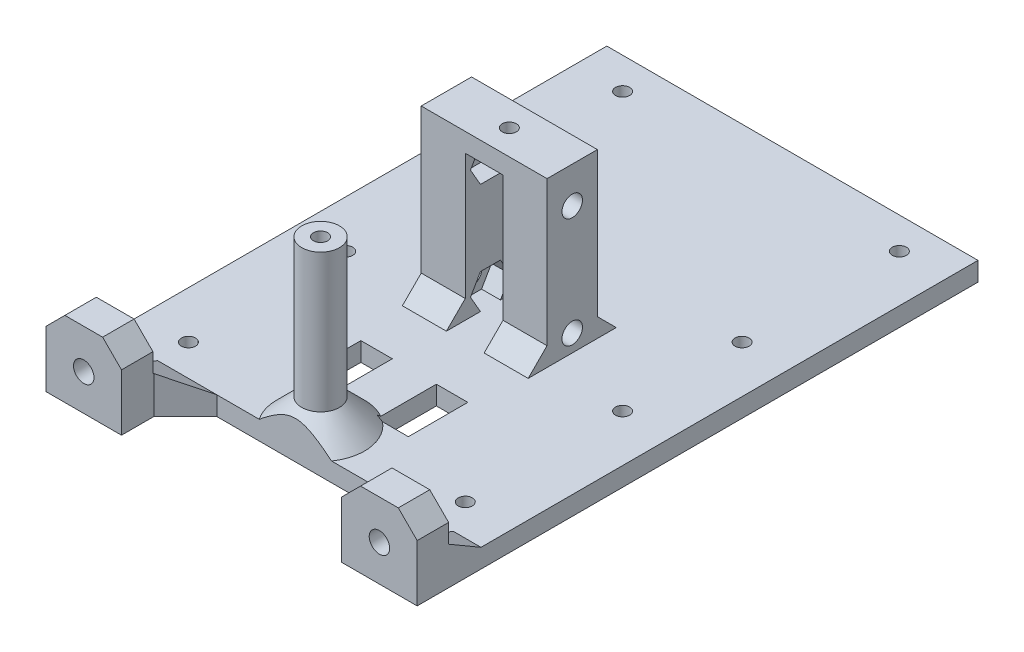
from build123d import *

# Parameters (mm, degrees)
BASE_DEPTH                     = 3
SKETCH1_W                      = 20
SKETCH1_H                      = 7
SKETCH1_H_2                    = 8
SKETCH1_W_2                    = 7
SKETCH1_H_3                    = 38.5
SOPORTE_MOTORES_DEPTH          = 23
SOPORTE_PALA_DEPTH             = 85.65548432
SKETCH3_R                      = 1.625
AGUJEROS_MOTORES_DEPTH         = 73.427902257
SKETCH4_R                      = 1
AGUJEROS_PALA_DEPTH            = 4
HUECO_SOPORTE_POSTERIOR_DEPTH  = 10
CORTE_SOPORTE_PALA_MOTOR_REACH = 71.098
BOSS_EXTRUDE2_DEPTH            = 20
CHAMFER1_SIZE                  = 3
CORTAR_EXTRUIR1_DEPTH          = 85.65548432
CORTAR_EXTRUIR1_DEPTH_BACK     = 85.65548432
SALIENTE_EXTRUIR1_START        = -59
SALIENTE_EXTRUIR1_DEPTH        = 12
SALIENTE_EXTRUIR2_DEPTH        = 12
CHAFL_N1_SIZE                  = 5
CROQUIS7_R                     = 1.625
CORTAR_EXTRUIR2_DEPTH          = 12
CORTAR_EXTRUIR3_DEPTH          = 15
CORTAR_EXTRUIR3_DEPTH_BACK     = 2.5
CORTAR_EXTRUIR5_DEPTH          = 86.730127162
CORTAR_EXTRUIR5_DEPTH_BACK     = 86.730127162
CROQUIS10_W                    = 13.75510153
CROQUIS10_H                    = 25.014777128
SALIENTE_EXTRUIR3_START        = -20
CROQUIS11_W                    = 8
CROQUIS11_H                    = 3
SALIENTE_EXTRUIR3_DEPTH        = 20
CORTAR_EXTRUIR6_START          = -11
CROQUIS12_W                    = 6
CROQUIS12_H                    = 23
CORTAR_EXTRUIR6_DEPTH          = 14
CORTAR_EXTRUIR7_DEPTH          = 9
CORTAR_EXTRUIR7_DEPTH_BACK     = 3
CHAFL_N2_SIZE                  = 3
CROQUIS14_R                    = 3
CROQUIS14_R_2                  = 1.125
SALIENTE_EXTRUIR4_DEPTH        = 26
CHAFL_N3_SIZE                  = 4
CORTAR_EXTRUIR8_REACH          = 72.028
CROQUIS15_R                    = 1.125
CROQUIS16_R                    = 1.125
CORTAR_EXTRUIR9_DEPTH          = 69.839702957


with BuildPart() as part:
    # Croquis1 → Base (new body)
    with BuildSketch(Plane(origin=(0, 0, 0), x_dir=(1, 0, 0), z_dir=(0, 1, 0))):
        Polygon((-29.5, 32.640625), (29.5, 32.640625), (29.5, -47.359375), (8.5, -47.359375), (8.5, -27.453125), (3.5, -27.453125), (3.5, -47.359375), (-3.5, -47.359375), (-3.5, -27.453125), (-8.5, -27.453125), (-8.5, -47.359375), (-29.5, -47.359375), align=None)
    extrude(amount=BASE_DEPTH)

    # Sketch1 → Soporte Motores (add)
    with BuildSketch(Plane(origin=(0, 3, 0), x_dir=(1, 0, 0), z_dir=(0, 1, 0))):
        with Locations((0, 19.640625)):
            Rectangle(SKETCH1_W, SKETCH1_H)
        with Locations((0, -12.359375)):
            Rectangle(SKETCH1_W, SKETCH1_H_2)
        with Locations((0, -35.609375)):
            Rectangle(SKETCH1_W_2, SKETCH1_H_3)
    extrude(amount=SOPORTE_MOTORES_DEPTH)

    # Sketch2 → Soporte Pala (cut, through all)
    with BuildSketch(Plane(origin=(29.5, 0, 0), x_dir=(0, 0, -1), z_dir=(1, 0, 0))):
        Polygon((-54.859375, 26), (-46.359375, 0), (-47.359375, 0), (-47.359375, 3), (-54.859375, 3), align=None)
    extrude(amount=-SOPORTE_PALA_DEPTH, mode=Mode.SUBTRACT)

    # Sketch3 → Agujeros Motores (cut, through all)
    with BuildSketch(Plane.ZY.offset(10)):
        with Locations((12.359375, 5.75)):
            Circle(SKETCH3_R)
        with Locations((12.359375, 23.25)):
            Circle(SKETCH3_R)
    extrude(amount=-AGUJEROS_MOTORES_DEPTH, mode=Mode.SUBTRACT)

    # Sketch4 → Agujeros pala (cut)
    with BuildSketch(Plane(origin=(0, -13.692511694, 41.882976946), x_dir=(1, 0, 0), z_dir=(0, -0.31073885630742226, 0.9504953251756452))):
        with Locations(Location((0, 19.405659167, 0), (0, 0, 270))):
            Circle(SKETCH4_R)
        with Locations(Location((0, 29.405659167, 0), (0, 0, 270))):
            Circle(SKETCH4_R)
    extrude(amount=-AGUJEROS_PALA_DEPTH, mode=Mode.SUBTRACT)

    # Croquis2 → Hueco Soporte Posterior (cut)
    with BuildSketch(Plane(origin=(0, 0, -23.140625), x_dir=(-1, 0, 0), z_dir=(0, 0, -1))):
        Polygon((-5, 6), (-5, 3), (5, 3), (5, 6), (5, 21), (-5, 21), align=None)
    extrude(amount=-HUECO_SOPORTE_POSTERIOR_DEPTH, mode=Mode.SUBTRACT)

    # Croquis3 → Corte_Soporte_PALA_MOTOR (cut, up to next)
    with BuildSketch(Plane.ZY.offset(3.5), mode=Mode.PRIVATE) as corte_soporte_pala_motor_sk1:
        Polygon((21.90625, 3), (36.90625, 3), (36.90625, 26), (21.90625, 26), (16.359375, 26), (16.359375, 3), align=None)
    corte_soporte_pala_motor_tool1 = extrude(corte_soporte_pala_motor_sk1.sketch, amount=-CORTE_SOPORTE_PALA_MOTOR_REACH, mode=Mode.PRIVATE) & part.part
    add(corte_soporte_pala_motor_tool1.solids().sort_by_distance((-3.5, 14.5, 26.632812))[0], mode=Mode.SUBTRACT)

    # Sketch5 → Boss-Extrude2 (add)
    with BuildSketch(Plane(origin=(-8.5, 0, 0), x_dir=(0, 0, -1), z_dir=(1, 0, 0))):
        Polygon((-36.90625, 3), (-36.90625, 0), (-46.359375, 0), (-47.340144231, 3), align=None)
    extrude(amount=BOSS_EXTRUDE2_DEPTH)

    # Chamfer1
    # the kernel refuses this chamfer: 3 mm, written as the material it adds along each edge
    with BuildSketch(Plane(origin=(10, 3, -16.140625), x_dir=(0, -0.02749587661058635, 0.9996219169112968), z_dir=(-1, 0, 0)), Plane(origin=(5, 3, -23.140625), x_dir=(0, -0.027495876610586365, -0.9996219169112968), z_dir=(1, 0, 0)), Plane(origin=(-5, 3, -16.140625), x_dir=(0, -0.02749587661058635, 0.9996219169112968), z_dir=(-1, 0, 0)), Plane(origin=(-10, 3, -23.140625), x_dir=(0, -0.027495876610586365, -0.9996219169112968), z_dir=(1, 0, 0))) as chamfer1_piece_1:
        Polygon((CHAMFER1_SIZE * 0.999621916911, CHAMFER1_SIZE * 0.0274958766106), (-CHAMFER1_SIZE * 0.0274958766106, CHAMFER1_SIZE * 0.999621916911), (0, 0), align=None)
    extrude(amount=5)
    with BuildSketch(Plane(origin=(-5, 3, -23.140625), x_dir=(0.9996219169112968, -0.027495876610586348, 0), z_dir=(0, 0, 1))) as chamfer1_piece_2:
        Polygon((CHAMFER1_SIZE * 0.999621916911, CHAMFER1_SIZE * 0.0274958766106), (-CHAMFER1_SIZE * 0.0274958766106, CHAMFER1_SIZE * 0.999621916911), (0, 0), align=None)
    extrude(amount=7)
    with BuildSketch(Plane(origin=(5, 3, -23.140625), x_dir=(-0.9996219169112968, -0.027495876610586348, 0), z_dir=(0, 0, 1))) as chamfer1_piece_3:
        Polygon((CHAMFER1_SIZE * 0.999621916911, -CHAMFER1_SIZE * 0.0274958766106), (-CHAMFER1_SIZE * 0.0274958766106, -CHAMFER1_SIZE * 0.999621916911), (0, 0), align=None)
    extrude(amount=7)
    with BuildSketch(Plane(origin=(-3.5, 3, 55.055193195), x_dir=(-0.9996219169112969, -0.027495876610586348, 0), z_dir=(0, 0, -1))) as chamfer1_piece_4_section:
        Polygon((CHAMFER1_SIZE * 0.999621916911, CHAMFER1_SIZE * 0.0274958766106), (-CHAMFER1_SIZE * 0.0274958766106, CHAMFER1_SIZE * 0.999621916911), (0, 0), align=None)
    chamfer1_piece_4 = extrude(amount=18.148943195, mode=Mode.PRIVATE)
    chamfer1_piece_4 = split(chamfer1_piece_4, bisect_by=Plane(origin=(-4.480095354, 2.417288908, 47.149642528), z_dir=(0, 0.3107388563074222, -0.9504953251756452)), keep=Keep.TOP, mode=Mode.PRIVATE)
    add(chamfer1_piece_4)
    with BuildSketch(Plane(origin=(3.5, 3, 36.90625), x_dir=(0.9996219169112969, -0.027495876610586348, 0), z_dir=(0, 0, 1))) as chamfer1_piece_5_section:
        Polygon((CHAMFER1_SIZE * 0.999621916911, CHAMFER1_SIZE * 0.0274958766106), (-CHAMFER1_SIZE * 0.0274958766106, CHAMFER1_SIZE * 0.999621916911), (0, 0), align=None)
    chamfer1_piece_5 = extrude(amount=18.148943195, mode=Mode.PRIVATE)
    chamfer1_piece_5 = split(chamfer1_piece_5, bisect_by=Plane(origin=(4.480095354, 2.417288908, 47.149642528), z_dir=(0, 0.3107388563074222, -0.9504953251756452)), keep=Keep.TOP, mode=Mode.PRIVATE)
    add(chamfer1_piece_5)
    with BuildSketch(Plane(origin=(-10, 3, 8.359375), x_dir=(0, -0.02749587661058634, -0.9996219169112968), z_dir=(1, 0, 0)), Plane(origin=(10, 3, 16.359375), x_dir=(0, -0.027495876610586334, 0.9996219169112968), z_dir=(-1, 0, 0))) as chamfer1_piece_6:
        Polygon((CHAMFER1_SIZE * 0.999621916911, CHAMFER1_SIZE * 0.0274958766106), (-CHAMFER1_SIZE * 0.0274958766106, CHAMFER1_SIZE * 0.999621916911), (0, 0), align=None)
    extrude(amount=20)
    with BuildSketch(Plane(origin=(5, 3, -23.140625), x_dir=(-0.9996219169112968, -0.027495876610586348, 0), z_dir=(0, 0, 1))) as chamfer1_piece_7a_section:
        Polygon((CHAMFER1_SIZE * 0.999621916911, -CHAMFER1_SIZE * 0.0274958766106), (-CHAMFER1_SIZE * 0.0274958766106, -CHAMFER1_SIZE * 0.999621916911), (0, 0), align=None)
    chamfer1_piece_7a = extrude(amount=14.715048964, mode=Mode.PRIVATE)
    chamfer1_piece_7a = split(chamfer1_piece_7a, bisect_by=Plane(origin=(4.01061912, 3.98938088, -16.140625), z_dir=(0, 0, 1)), keep=Keep.TOP, mode=Mode.PRIVATE)
    with BuildSketch(Plane(origin=(10, 3, -16.140625), x_dir=(0, -0.02749587661058635, 0.9996219169112968), z_dir=(-1, 0, 0))) as chamfer1_piece_7b_section:
        Polygon((CHAMFER1_SIZE * 0.999621916911, CHAMFER1_SIZE * 0.0274958766106), (-CHAMFER1_SIZE * 0.0274958766106, CHAMFER1_SIZE * 0.999621916911), (0, 0), align=None)
    chamfer1_piece_7b = extrude(amount=12.715048964, mode=Mode.PRIVATE)
    chamfer1_piece_7b = split(chamfer1_piece_7b, bisect_by=Plane(origin=(5, 3.98938088, -15.15124412), z_dir=(-1, 0, 0)), keep=Keep.TOP, mode=Mode.PRIVATE)
    chamfer1_piece_7 = chamfer1_piece_7a & chamfer1_piece_7b
    add(chamfer1_piece_7)
    with BuildSketch(Plane(origin=(-2.715048964, 3, -23.140625), x_dir=(0, -0.027495876610586334, -0.9996219169112968), z_dir=(1, 0, 0))) as chamfer1_piece_8a_section:
        Polygon((CHAMFER1_SIZE * 0.999621916911, CHAMFER1_SIZE * 0.0274958766106), (-CHAMFER1_SIZE * 0.0274958766106, CHAMFER1_SIZE * 0.999621916911), (0, 0), align=None)
    chamfer1_piece_8a = extrude(amount=12.715048964, mode=Mode.PRIVATE)
    chamfer1_piece_8a = split(chamfer1_piece_8a, bisect_by=Plane(origin=(5, 3.98938088, -24.13000588), z_dir=(-1, 0, 0)), keep=Keep.TOP, mode=Mode.PRIVATE)
    with BuildSketch(Plane(origin=(5, 3, -30.855673964), x_dir=(-0.9996219169112968, -0.027495876610586348, 0), z_dir=(0, 0, 1))) as chamfer1_piece_8b_section:
        Polygon((CHAMFER1_SIZE * 0.999621916911, -CHAMFER1_SIZE * 0.0274958766106), (-CHAMFER1_SIZE * 0.0274958766106, -CHAMFER1_SIZE * 0.999621916911), (0, 0), align=None)
    chamfer1_piece_8b = extrude(amount=14.715048964, mode=Mode.PRIVATE)
    chamfer1_piece_8b = split(chamfer1_piece_8b, bisect_by=Plane(origin=(4.01061912, 3.98938088, -23.140625), z_dir=(0, 0, -1)), keep=Keep.TOP, mode=Mode.PRIVATE)
    chamfer1_piece_8 = chamfer1_piece_8a & chamfer1_piece_8b
    add(chamfer1_piece_8)
    with BuildSketch(Plane(origin=(-10, 3, -23.140625), x_dir=(0, -0.027495876610586365, -0.9996219169112968), z_dir=(1, 0, 0))) as chamfer1_piece_9a_section:
        Polygon((CHAMFER1_SIZE * 0.999621916911, CHAMFER1_SIZE * 0.0274958766106), (-CHAMFER1_SIZE * 0.0274958766106, CHAMFER1_SIZE * 0.999621916911), (0, 0), align=None)
    chamfer1_piece_9a = extrude(amount=12.715048964, mode=Mode.PRIVATE)
    chamfer1_piece_9a = split(chamfer1_piece_9a, bisect_by=Plane(origin=(-5, 3.98938088, -24.13000588), z_dir=(1, 0, 0)), keep=Keep.TOP, mode=Mode.PRIVATE)
    with BuildSketch(Plane(origin=(-5, 3, -30.855673964), x_dir=(0.9996219169112968, -0.027495876610586348, 0), z_dir=(0, 0, 1))) as chamfer1_piece_9b_section:
        Polygon((CHAMFER1_SIZE * 0.999621916911, CHAMFER1_SIZE * 0.0274958766106), (-CHAMFER1_SIZE * 0.0274958766106, CHAMFER1_SIZE * 0.999621916911), (0, 0), align=None)
    chamfer1_piece_9b = extrude(amount=14.715048964, mode=Mode.PRIVATE)
    chamfer1_piece_9b = split(chamfer1_piece_9b, bisect_by=Plane(origin=(-4.01061912, 3.98938088, -23.140625), z_dir=(0, 0, -1)), keep=Keep.TOP, mode=Mode.PRIVATE)
    chamfer1_piece_9 = chamfer1_piece_9a & chamfer1_piece_9b
    add(chamfer1_piece_9)
    with BuildSketch(Plane(origin=(2.715048964, 3, -16.140625), x_dir=(0, -0.02749587661058635, 0.9996219169112968), z_dir=(-1, 0, 0))) as chamfer1_piece_10a_section:
        Polygon((CHAMFER1_SIZE * 0.999621916911, CHAMFER1_SIZE * 0.0274958766106), (-CHAMFER1_SIZE * 0.0274958766106, CHAMFER1_SIZE * 0.999621916911), (0, 0), align=None)
    chamfer1_piece_10a = extrude(amount=12.715048964, mode=Mode.PRIVATE)
    chamfer1_piece_10a = split(chamfer1_piece_10a, bisect_by=Plane(origin=(-5, 3.98938088, -15.15124412), z_dir=(1, 0, 0)), keep=Keep.TOP, mode=Mode.PRIVATE)
    with BuildSketch(Plane(origin=(-5, 3, -23.140625), x_dir=(0.9996219169112968, -0.027495876610586348, 0), z_dir=(0, 0, 1))) as chamfer1_piece_10b_section:
        Polygon((CHAMFER1_SIZE * 0.999621916911, CHAMFER1_SIZE * 0.0274958766106), (-CHAMFER1_SIZE * 0.0274958766106, CHAMFER1_SIZE * 0.999621916911), (0, 0), align=None)
    chamfer1_piece_10b = extrude(amount=14.715048964, mode=Mode.PRIVATE)
    chamfer1_piece_10b = split(chamfer1_piece_10b, bisect_by=Plane(origin=(-4.01061912, 3.98938088, -16.140625), z_dir=(0, 0, 1)), keep=Keep.TOP, mode=Mode.PRIVATE)
    chamfer1_piece_10 = chamfer1_piece_10a & chamfer1_piece_10b
    add(chamfer1_piece_10)

    # Croquis4 → Cortar-Extruir1 (cut, two sides: drawn at the far end of the back side and taken through both)
    with BuildSketch(Plane.ZY.offset(29.5).offset(-CORTAR_EXTRUIR1_DEPTH_BACK)):
        Polygon((36.90625, 26), (36.90625, 3), (46.359375, 3), (46.359375, 0), (54.859375, 26), align=None)
    extrude(amount=CORTAR_EXTRUIR1_DEPTH + CORTAR_EXTRUIR1_DEPTH_BACK, mode=Mode.SUBTRACT)

    # Croquis5 → Saliente-Extruir1 (add)
    with BuildSketch(Plane.ZY.offset(29.5).offset(SALIENTE_EXTRUIR1_START)):
        Polygon((46.359375, 0), (56.503581331, 0), (56.503581331, 12), (51.503581331, 12), (51.503581331, 6), (46.359375, 3), align=None)
    extrude(amount=SALIENTE_EXTRUIR1_DEPTH)

    # Croquis6 → Saliente-Extruir2 (add)
    with BuildSketch(Plane.ZY.offset(29.5)):
        Polygon((46.359375, 3), (46.359375, 0), (56.503581331, 0), (56.503581331, 12), (51.503581331, 12), (51.503581331, 6), align=None)
    extrude(amount=-SALIENTE_EXTRUIR2_DEPTH)

    # Chaflán1
    chafl_n1_edges = [part.edges().sort_by_distance(p)[0] for p in [
        (-17.5, 1.5, 46.359375),
        (17.5, 1.5, 46.359375),
    ]]
    chamfer(chafl_n1_edges, length=CHAFL_N1_SIZE)

    # Croquis7 → Cortar-Extruir2 (cut)
    with BuildSketch(Plane.XY.offset(56.503581331)):
        with Locations((-23.5, 5.75)):
            Circle(CROQUIS7_R)
        with Locations(Location((23.5, 5.75, 0), (0, 0, 8.849883098))):
            Circle(CROQUIS7_R)
    extrude(amount=-CORTAR_EXTRUIR2_DEPTH, mode=Mode.SUBTRACT)

    # Croquis8 → Cortar-Extruir3 (cut, two sides: drawn at the far end of the back side and taken through both)
    with BuildSketch(Plane(origin=(0, 0, 51.503581331), x_dir=(-1, 0, 0), z_dir=(0, 0, -1)).offset(-CORTAR_EXTRUIR3_DEPTH_BACK)):
        Polygon((-21.91228676, 3), (-20.324573519, 5.75), (-21.91228676, 8.5), (-25.08771324, 8.5), (-26.675426481, 5.75), (-25.08771324, 3), align=None)
        Polygon((25.08771324, 3), (26.675426481, 5.75), (25.08771324, 8.5), (21.91228676, 8.5), (20.324573519, 5.75), (21.91228676, 3), align=None)
    extrude(amount=CORTAR_EXTRUIR3_DEPTH + CORTAR_EXTRUIR3_DEPTH_BACK, mode=Mode.SUBTRACT)

    # Croquis10 → Cortar-Extruir5 (cut, two sides: drawn at the far end of the back side and taken through both)
    with BuildSketch(Plane.ZY.offset(29.5).offset(-CORTAR_EXTRUIR5_DEPTH_BACK)):
        with Locations((-19.263074235, 15.507388564)):
            Rectangle(CROQUIS10_W, CROQUIS10_H)
    extrude(amount=CORTAR_EXTRUIR5_DEPTH + CORTAR_EXTRUIR5_DEPTH_BACK, mode=Mode.SUBTRACT)

    # Croquis11 → Saliente-Extruir3 (add)
    with BuildSketch(Plane.ZY.offset(10).offset(SALIENTE_EXTRUIR3_START)):
        with Locations((12.359375, 27.5)):
            Rectangle(CROQUIS11_W, CROQUIS11_H)
    extrude(amount=SALIENTE_EXTRUIR3_DEPTH)

    # Croquis12 → Cortar-Extruir6 (cut)
    with BuildSketch(Plane(origin=(0, 0, 8.359375), x_dir=(-1, 0, 0), z_dir=(0, 0, -1)).offset(CORTAR_EXTRUIR6_START)):
        with Locations((0, 14.5)):
            Rectangle(CROQUIS12_W, CROQUIS12_H)
    extrude(amount=CORTAR_EXTRUIR6_DEPTH, mode=Mode.SUBTRACT)

    # Croquis13 → Cortar-Extruir7 (cut, two sides: drawn at the far end of the back side and taken through both)
    with BuildSketch(Plane.ZY.offset(-3).offset(-CORTAR_EXTRUIR7_DEPTH_BACK)):
        Polygon((13.94708824, 3), (15.534801481, 5.75), (13.94708824, 8.5), (10.77166176, 8.5), (9.183948519, 5.75), (10.77166176, 3), align=None)
        Polygon((13.94708824, 20.5), (15.534801481, 23.25), (13.94708824, 26), (10.77166176, 26), (9.183948519, 23.25), (10.77166176, 20.5), align=None)
    extrude(amount=CORTAR_EXTRUIR7_DEPTH + CORTAR_EXTRUIR7_DEPTH_BACK, mode=Mode.SUBTRACT)

    # Chaflán2
    chafl_n2_edges = [part.edges().sort_by_distance(p)[0] for p in [
        (29.5, 12, 54.003581331),
        (17.5, 12, 54.003581331),
        (-17.5, 12, 54.003581331),
        (-29.5, 12, 54.003581331),
    ]]
    chamfer(chafl_n2_edges, length=CHAFL_N2_SIZE)

    # Croquis14 → Saliente-Extruir4 (add)
    with BuildSketch(Plane(origin=(0, 3, 0), x_dir=(1, 0, 0), z_dir=(0, 1, 0))):
        with Locations(Location((0, -42.359375, 0), (0, 0, 90))):
            Circle(CROQUIS14_R)
        with Locations(Location((0, -42.359375, 0), (0, 0, 90))):
            Circle(CROQUIS14_R_2, mode=Mode.SUBTRACT)
    extrude(amount=SALIENTE_EXTRUIR4_DEPTH)

    # Chaflán3
    # the kernel refuses this chamfer: 4 mm, written as the material it adds along each edge
    with BuildSketch(Plane(origin=(0, 3, 42.359375), x_dir=(0, 0, -1), z_dir=(1, 0, 0))) as chafl_n3_piece_1_section:
        Polygon((3 + CHAFL_N3_SIZE, 0), (3, CHAFL_N3_SIZE), (3, 0), align=None)
    chafl_n3_piece_1 = revolve(axis=Axis((0, 3, 42.359375), (0, 1, 0)), mode=Mode.PRIVATE)
    chafl_n3_piece_1 = split(chafl_n3_piece_1, bisect_by=Plane(origin=(3.5, 3.340068144, 36.394025083), z_dir=(-1, 0, 0)), keep=Keep.TOP, mode=Mode.PRIVATE)
    chafl_n3_piece_1 = split(chafl_n3_piece_1, bisect_by=Plane(origin=(-4.39e-07, 3.340068144, 36.90625), z_dir=(0, 0, -1)), keep=Keep.TOP, mode=Mode.PRIVATE)
    chafl_n3_piece_1 = split(chafl_n3_piece_1, bisect_by=Plane(origin=(-3.5, 3.340068144, 36.394025083), z_dir=(1, 0, 0)), keep=Keep.TOP, mode=Mode.PRIVATE)
    add(chafl_n3_piece_1)
    with BuildSketch(Plane(origin=(0, 3, 42.359375), x_dir=(0, 0, -1), z_dir=(1, 0, 0))) as chafl_n3_piece_2_section:
        Polygon((3 + CHAFL_N3_SIZE, 0), (3, CHAFL_N3_SIZE), (3, 0), align=None)
    chafl_n3_piece_2 = revolve(axis=Axis((0, 3, 42.359375), (0, 1, 0)), mode=Mode.PRIVATE)
    chafl_n3_piece_2 = split(chafl_n3_piece_2, bisect_by=Plane(origin=(-2.988556575, 6.479548146, 46.359375), z_dir=(0, 0, -1)), keep=Keep.TOP, mode=Mode.PRIVATE)
    chafl_n3_piece_2 = split(chafl_n3_piece_2, bisect_by=Plane(origin=(3.5, 6.479548146, 40.633931057), z_dir=(-1, 0, 0)), keep=Keep.TOP, mode=Mode.PRIVATE)
    chafl_n3_piece_2 = split(chafl_n3_piece_2, bisect_by=Plane(origin=(-2.988556575, 6.479548146, 36.90625), z_dir=(0, 0, 1)), keep=Keep.TOP, mode=Mode.PRIVATE)
    chafl_n3_piece_2 = split(chafl_n3_piece_2, bisect_by=Plane(origin=(-3.5, 6.479548146, 40.633931057), z_dir=(1, 0, 0)), keep=Keep.TOP, mode=Mode.PRIVATE)
    add(chafl_n3_piece_2)
    with BuildSketch(Plane(origin=(0, 3, 42.359375), x_dir=(0, 0, -1), z_dir=(1, 0, 0))) as chafl_n3_piece_3_section:
        Polygon((3 + CHAFL_N3_SIZE, 0), (3, CHAFL_N3_SIZE), (3, 0), align=None)
    chafl_n3_piece_3 = revolve(axis=Axis((0, 3, 42.359375), (0, 1, 0)), mode=Mode.PRIVATE)
    chafl_n3_piece_3 = split(chafl_n3_piece_3, bisect_by=Plane(origin=(4.611201091, 3.904827773, 46.359375), z_dir=(0, 0, -1)), keep=Keep.TOP, mode=Mode.PRIVATE)
    chafl_n3_piece_3 = split(chafl_n3_piece_3, bisect_by=Plane(origin=(3.5, 3.904827773, 42.156936652), z_dir=(1, 0, 0)), keep=Keep.TOP, mode=Mode.PRIVATE)
    chafl_n3_piece_3 = split(chafl_n3_piece_3, bisect_by=Plane(origin=(4.611201091, 3.904827773, 36.90625), z_dir=(0, 0, 1)), keep=Keep.TOP, mode=Mode.PRIVATE)
    add(chafl_n3_piece_3)
    with BuildSketch(Plane(origin=(0, 3, 42.359375), x_dir=(0, 0, -1), z_dir=(1, 0, 0))) as chafl_n3_piece_4_section:
        Polygon((3 + CHAFL_N3_SIZE, 0), (3, CHAFL_N3_SIZE), (3, 0), align=None)
    chafl_n3_piece_4 = revolve(axis=Axis((0, 3, 42.359375), (0, 1, 0)), mode=Mode.PRIVATE)
    chafl_n3_piece_4 = split(chafl_n3_piece_4, bisect_by=Plane(origin=(-4.611201101, 3.904827807, 46.359375), z_dir=(0, 0, -1)), keep=Keep.TOP, mode=Mode.PRIVATE)
    chafl_n3_piece_4 = split(chafl_n3_piece_4, bisect_by=Plane(origin=(-4.611201101, 3.904827807, 36.90625), z_dir=(0, 0, 1)), keep=Keep.TOP, mode=Mode.PRIVATE)
    chafl_n3_piece_4 = split(chafl_n3_piece_4, bisect_by=Plane(origin=(-3.5, 3.904827807, 42.156936756), z_dir=(-1, 0, 0)), keep=Keep.TOP, mode=Mode.PRIVATE)
    add(chafl_n3_piece_4)

    # Croquis15 → Cortar-Extruir8 (cut, up to next)
    with BuildSketch(Plane(origin=(0, 29, 0), x_dir=(1, 0, 0), z_dir=(0, 1, 0)), mode=Mode.PRIVATE) as cortar_extruir8_sk1:
        with Locations(Location((0, -12.359375, 0), (0, 0, 270))):
            Circle(CROQUIS15_R)
    cortar_extruir8_tool1 = extrude(cortar_extruir8_sk1.sketch, amount=-CORTAR_EXTRUIR8_REACH, mode=Mode.PRIVATE) & part.part
    add(cortar_extruir8_tool1.solids().sort_by_distance((0, 29, 12.359375))[0], mode=Mode.SUBTRACT)

    # Croquis16 → Cortar-Extruir9 (cut, through all)
    with BuildSketch(Plane(origin=(0, 3, 0), x_dir=(1, 0, 0), z_dir=(0, 1, 0))):
        with Locations(Location((-22, -41.359375, 0), (0, 0, 270))):
            Circle(CROQUIS16_R)
        with Locations(Location((22, -41.359375, 0), (0, 0, 270))):
            Circle(CROQUIS16_R)
        with Locations(Location((-22, 2.640625, 0), (0, 0, 270))):
            Circle(CROQUIS16_R)
        with Locations(Location((22, 2.640625, 0), (0, 0, 270))):
            Circle(CROQUIS16_R)
        with Locations(Location((-22, 27.640625, 0), (0, 0, 270))):
            Circle(CROQUIS16_R)
        with Locations(Location((22, 27.640625, 0), (0, 0, 270))):
            Circle(CROQUIS16_R)
        with Locations(Location((-22, -16.359375, 0), (0, 0, 270))):
            Circle(CROQUIS16_R)
        with Locations(Location((22, -16.359375, 0), (0, 0, 270))):
            Circle(CROQUIS16_R)
    extrude(amount=-CORTAR_EXTRUIR9_DEPTH, mode=Mode.SUBTRACT)


solid = part.part
